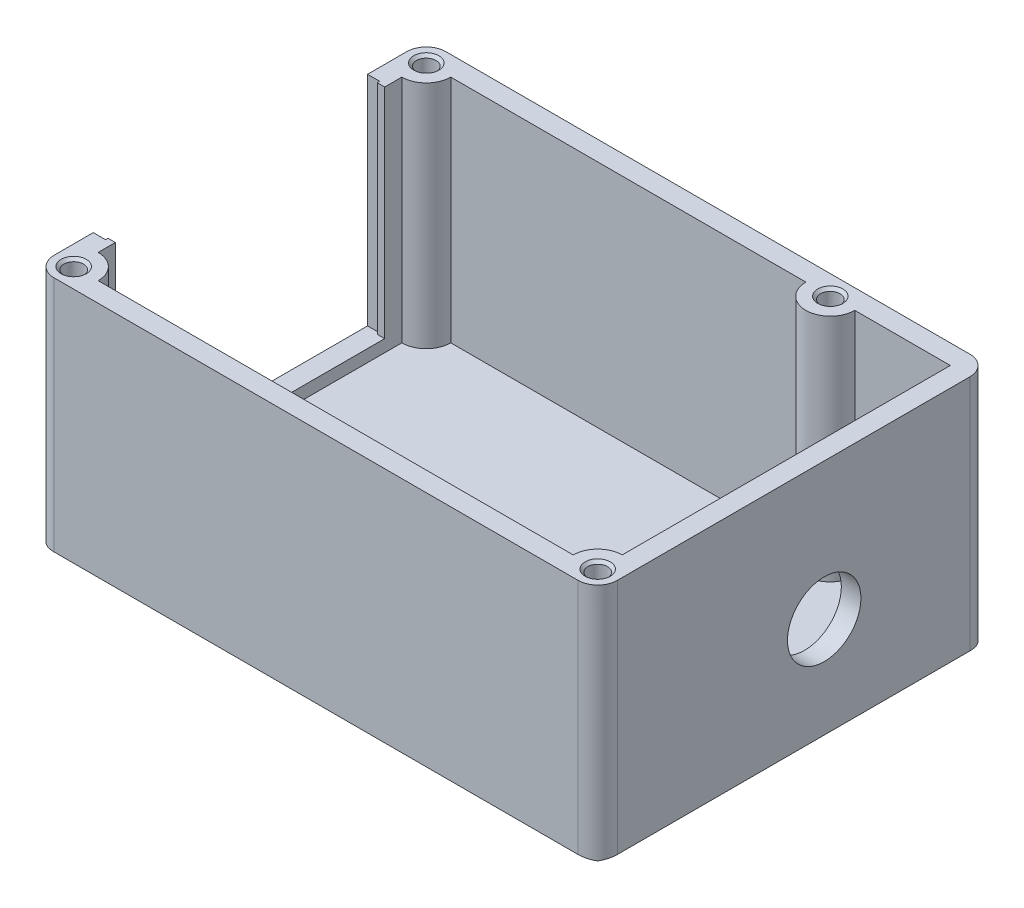
from build123d import *

# Parameters (mm, degrees)
SKETCH1_W                       = 46
SKETCH1_H                       = 32
BOSS_EXTRUDE1_DEPTH             = 20.6
M2X0_4_TAPPED_HOLE1_D           = 1.6
M2X0_4_TAPPED_HOLE1_DEPTH       = 6
M2X0_4_TAPPED_HOLE1_CSINK_D     = 2.05
M2X0_4_TAPPED_HOLE1_CSINK_ANGLE = 90
M2X0_4_TAPPED_HOLE1_TIP         = 0.480688495
FILLET1_R                       = 1.6
SKETCH4_R                       = 6
BOSS_EXTRUDE2_DEPTH             = 0.5
CUT_EXTRUDE3_DEPTH              = 18.8
SKETCH6_W                       = 2
SKETCH6_H                       = 22
CUT_EXTRUDE1_DEPTH              = 17.8
SKETCH7_W                       = 1
SKETCH7_H                       = 22.4
CUT_EXTRUDE2_DEPTH              = 17.8
SKETCH9_R                       = 3
CUT_EXTRUDE4_DEPTH              = 54.077396319
CHAMFER1_SIZE                   = 4.5
CHAMFER1_SIZE_2                 = 1.205771366


with BuildPart() as part:
    # Sketch1 → Boss-Extrude1 (new body)
    with BuildSketch(Plane(origin=(0, 0, 0), x_dir=(1, 0, 0), z_dir=(0, 1, 0))):
        with Locations((9, 0)):
            Rectangle(SKETCH1_W, SKETCH1_H)
    extrude(amount=-BOSS_EXTRUDE1_DEPTH)

    # M2x0.4 Tapped Hole1
    with Locations(Plane(origin=(0, 0, 0), x_dir=(1, 0, 0), z_dir=(0, 1, 0))):
        with Locations((-12.4, 14.4), (20.6, 14.4), (30.4, -14.4), (-12.4, -14.4)):
            CounterSinkHole(M2X0_4_TAPPED_HOLE1_D / 2, M2X0_4_TAPPED_HOLE1_CSINK_D / 2, depth=M2X0_4_TAPPED_HOLE1_DEPTH, counter_sink_angle=M2X0_4_TAPPED_HOLE1_CSINK_ANGLE)
            with Locations((0, 0, -(M2X0_4_TAPPED_HOLE1_DEPTH + M2X0_4_TAPPED_HOLE1_TIP / 2))):  # 118° drill point
                Cone(0, M2X0_4_TAPPED_HOLE1_D / 2, M2X0_4_TAPPED_HOLE1_TIP, mode=Mode.SUBTRACT)

    # Fillet1
    fillet1_edges = [part.edges().sort_by_distance(p)[0] for p in [
        (-14, -10.3, -16),
        (32, -10.3, -16),
        (32, -10.3, 16),
        (-14, -10.3, 16),
    ]]
    fillet(fillet1_edges, radius=FILLET1_R)

    # Sketch4 → Boss-Extrude2 (add)
    with BuildSketch(Plane(origin=(0, -20.6, 0), x_dir=(-1, 0, 0), z_dir=(0, -1, 0))):
        with Locations(Location((0, 0, 0), (0, 0, 270))):
            Circle(SKETCH4_R)
    extrude(amount=BOSS_EXTRUDE2_DEPTH)

    # Sketch8 → Cut-Extrude3 (cut)
    with BuildSketch(Plane(origin=(0, 0, 0), x_dir=(1, 0, 0), z_dir=(0, 1, 0))):
        with BuildLine():
            Line((-10.4, 14.4), (18.6, 14.4))
            ThreePointArc((18.6, 14.4), (20.6, 12.4), (22.6, 14.4))
            Line((22.6, 14.4), (30.4, 14.4))
            Line((30.4, 14.4), (30.4, -12.4))
            ThreePointArc((30.4, -12.4), (28.985786438, -12.985786438), (28.4, -14.4))
            Line((28.4, -14.4), (-10.4, -14.4))
            ThreePointArc((-10.4, -14.4), (-10.985786438, -12.985786438), (-12.4, -12.4))
            Line((-12.4, -12.4), (-12.4, 12.4))
            ThreePointArc((-12.4, 12.4), (-10.985786438, 12.985786438), (-10.4, 14.4))
        make_face()
    extrude(amount=-CUT_EXTRUDE3_DEPTH, mode=Mode.SUBTRACT)

    # Sketch6 → Cut-Extrude1 (cut)
    with BuildSketch(Plane(origin=(0, 0, 0), x_dir=(1, 0, 0), z_dir=(0, 1, 0))):
        with Locations((-13, 0)):
            Rectangle(SKETCH6_W, SKETCH6_H)
    extrude(amount=-CUT_EXTRUDE1_DEPTH, mode=Mode.SUBTRACT)

    # Sketch7 → Cut-Extrude2 (cut)
    with BuildSketch(Plane(origin=(0, 0, 0), x_dir=(1, 0, 0), z_dir=(0, 1, 0))):
        with Locations((-13.5, 0)):
            Rectangle(SKETCH7_W, SKETCH7_H)
    extrude(amount=-CUT_EXTRUDE2_DEPTH, mode=Mode.SUBTRACT)

    # Sketch9 → Cut-Extrude4 (cut, through all)
    with BuildSketch(Plane(origin=(32, 0, 0), x_dir=(0, 0, -1), z_dir=(1, 0, 0))):
        with Locations((2.5, -11.2)):
            Circle(SKETCH9_R)
    extrude(amount=-CUT_EXTRUDE4_DEPTH, mode=Mode.SUBTRACT)

    # Chamfer1
    # the kernel refuses this chamfer: 4.5, 1.205771366 mm, written as the material it takes off along each edge
    with BuildSketch(Plane(origin=(42.085247066, -20.6, 16), x_dir=(0, -0.009967146577156305, -0.9999503267608394), z_dir=(-1, 0, 0))) as chamfer1_piece_1:
        Polygon((CHAMFER1_SIZE * 0.999950326761, -CHAMFER1_SIZE * 0.00996714657716), (-CHAMFER1_SIZE_2 * 0.00996714657666, -CHAMFER1_SIZE_2 * 0.999950326711), (0, 0), align=None)
    extrude(amount=66.170494132, mode=Mode.SUBTRACT)
    with BuildSketch(Plane(origin=(-14, -20.6, 26.085247066), x_dir=(0.9999503267608394, -0.009967146577156305, 0), z_dir=(0, 0, -1)), Plane(origin=(32, -20.6, -26.085247066), x_dir=(-0.9999503267608394, -0.009967146577156302, 0), z_dir=(0, 0, 1))) as chamfer1_piece_2:
        Polygon((CHAMFER1_SIZE * 0.999950326761, -CHAMFER1_SIZE * 0.00996714657716), (-CHAMFER1_SIZE_2 * 0.00996714657666, -CHAMFER1_SIZE_2 * 0.999950326711), (0, 0), align=None)
    extrude(amount=52.170494132, mode=Mode.SUBTRACT)
    with BuildSketch(Plane(origin=(-24.085247066, -20.6, -16), x_dir=(0, 0.9905000388259543, -0.1375124470212905), z_dir=(1, 0, 0))) as chamfer1_piece_3:
        Polygon((CHAMFER1_SIZE_2 * 0.990500038777, CHAMFER1_SIZE_2 * 0.137512447014), (-CHAMFER1_SIZE * 0.137512447021, CHAMFER1_SIZE * 0.990500038826), (0, 0), align=None)
    extrude(amount=66.170494132, mode=Mode.SUBTRACT)


solid = part.part
